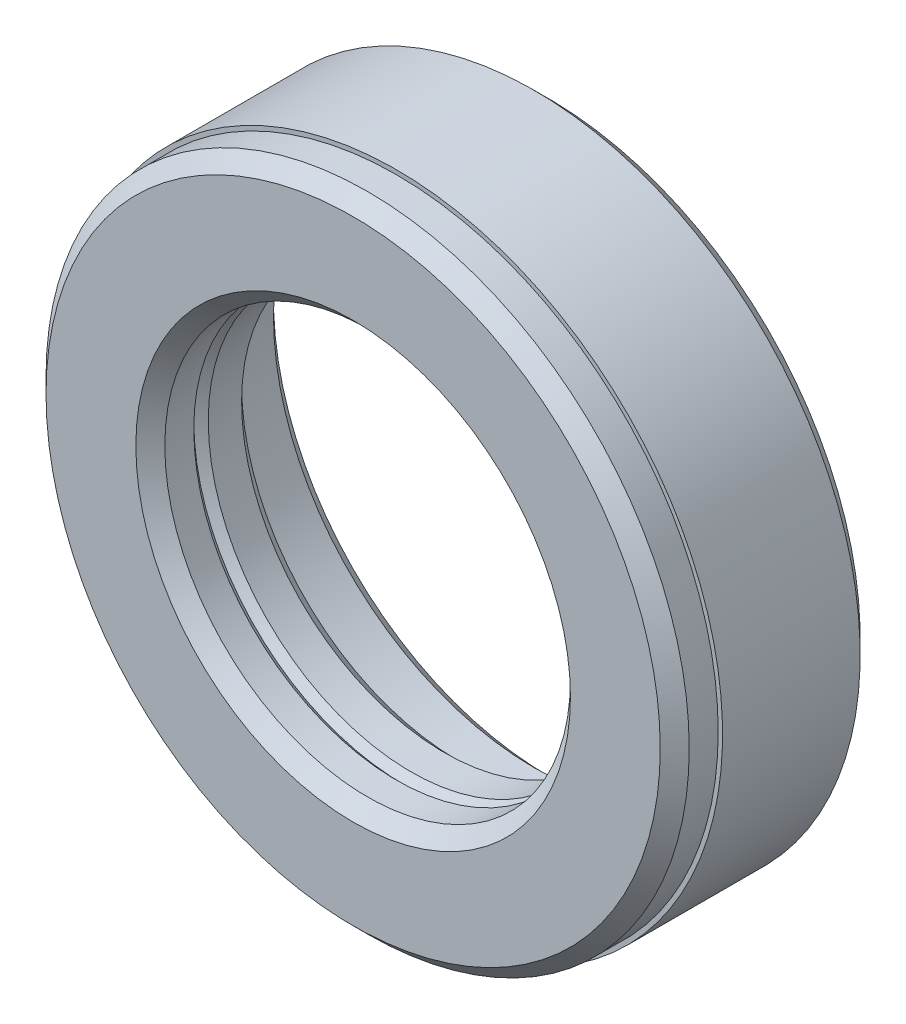
from build123d import *

# Parameters (mm, degrees)
CHAMFER1_SIZE = 1


with BuildPart() as part:
    # Sketch1 → Revolve1 (revolve)
    with BuildSketch(Plane(origin=(0, 0, 0), x_dir=(0, 0, -1), z_dir=(1, 0, 0))):
        Polygon((0, 0), (-13.5, 0), (-13.5, 21.2), (-12.5, 22.2), (-10.5, 22.2), (-10.5, 22.5), (-1, 22.5), (0, 21.5), align=None)
    revolve(axis=Axis((0, 0, 0), (0, 0, 1)))

    # Sketch2 → Cut-Revolve1 (revolve, cut)
    with BuildSketch(Plane(origin=(0, 0, 0), x_dir=(0, 0, -1), z_dir=(1, 0, 0))):
        Polygon((0, 0), (-13.5, 0), (-13.5, 14), (-10.5, 14), (-10, 14.5), (-9.5, 14), (-7.2, 14), (-6.2, 15), (-6.2, 18), (0, 18), align=None)
    revolve(axis=Axis((0, 0, 0), (0, 0, 1)), mode=Mode.SUBTRACT)

    # Chamfer1
    chamfer1_edges = [part.edges().sort_by_distance(p)[0] for p in [
        (0, -18, 0),
        (0, -14, 13.5),
    ]]
    chamfer(chamfer1_edges, length=CHAMFER1_SIZE)


solid = part.part
